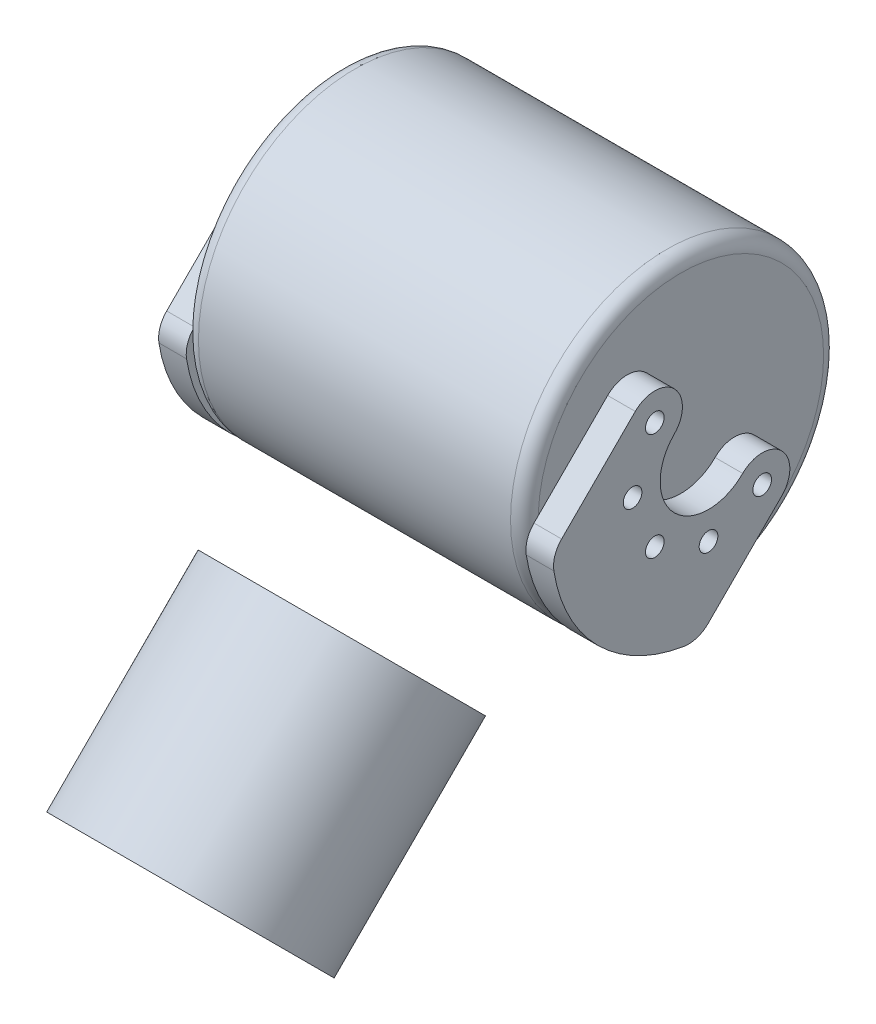
from build123d import *

# Parameters (mm, degrees)
BOSS_EXTRUDE1_START = 24.6
SKETCH2_R           = 1.35
BOSS_EXTRUDE1_DEPTH = 4
FILLET1_R           = 4
BOSS_EXTRUDE3_START = -24.6
SKETCH3_R           = 22.670832933
BOSS_EXTRUDE3_DEPTH = 49.2
FILLET2_R           = 2
SKETCH4_R           = 17
SKETCH4_R_2         = 12.95
BOSS_EXTRUDE4_DEPTH = 30
BOSS_EXTRUDE5_START = 1
SKETCH5_R           = 17
SKETCH5_R_2         = 15
BOSS_EXTRUDE5_DEPTH = 1


# Read off the part's stored shape, not the designer's step: Body-Move/Copy2
with BuildPart() as part:
    # Body-Move/Copy2 outline → Body-Move/Copy2 (revolve)
    with BuildSketch(Plane(origin=(0, 176.776695297, 176.776695297), x_dir=(1, 0, 0), z_dir=(0, 0.7071067811865516, 0.7071067811865436))):
        with BuildLine():
            Line((10.95, -34.670832933), (10.95, -53.670832933))
            Line((10.95, -53.670832933), (12.95, -53.670832933))
            Line((12.95, -53.670832933), (12.95, -49.40288374))
            ThreePointArc((12.95, -49.40288374), (12.2, -48.103845634), (12.95, -46.804807529))
            Line((12.95, -46.804807529), (12.95, -42.536858337))
            ThreePointArc((12.95, -42.536858337), (12.2, -41.237820231), (12.95, -39.938782125))
            Line((12.95, -39.938782125), (12.95, -35.670832933))
            Line((12.95, -35.670832933), (15, -35.670832933))
            Line((15, -35.670832933), (15, -34.670832933))
            Line((15, -34.670832933), (10.95, -34.670832933))
        make_face()
    revolve(axis=Axis((0, 176.776695297, 176.776695297), (0, 0.7071067811865436, -0.7071067811865516)))


with BuildPart() as body_2:
    # Sketch2 → Boss-Extrude1 (new body)
    with BuildSketch(Plane(origin=(0, 0, 0), x_dir=(0, 0, -1), z_dir=(1, 0, 0)).offset(BOSS_EXTRUDE1_START)):
        with BuildLine():
            Line((-187.383297014, 187.383297014), (-199.403419016, 175.363175013))
            ThreePointArc((-199.403419016, 175.363175013), (-192.807394999, 160.745995595), (-178.19021558, 154.149971577))
            Line((-178.19021558, 154.149971577), (-166.170093579, 166.170093579))
            ThreePointArc((-166.170093579, 166.170093579), (-166.170093579, 171.826947828), (-171.826947828, 171.826947828))
            ThreePointArc((-171.826947828, 171.826947828), (-181.726442765, 171.826947828), (-181.726442765, 181.726442765))
            ThreePointArc((-181.726442765, 181.726442765), (-181.726442765, 187.383297014), (-187.383297014, 187.383297014))
        make_face()
        with Locations((-184.55486989, 168.998520704)):
            Circle(SKETCH2_R, mode=Mode.SUBTRACT)
        with Locations((-184.55486989, 184.55486989)):
            Circle(SKETCH2_R, mode=Mode.SUBTRACT)
        with Locations((-187.776695297, 176.776695297)):
            Circle(SKETCH2_R, mode=Mode.SUBTRACT)
        with Locations((-176.776695297, 165.776695297)):
            Circle(SKETCH2_R, mode=Mode.SUBTRACT)
        with Locations((-168.998520704, 168.998520704)):
            Circle(SKETCH2_R, mode=Mode.SUBTRACT)
    extrude(amount=BOSS_EXTRUDE1_DEPTH)

    # Fillet1
    fillet1_edges = [body_2.edges().sort_by_distance(p)[0] for p in [
        (26.6, 154.149971577, 178.19021558),
        (26.6, 175.363175013, 199.403419016),
    ]]
    fillet(fillet1_edges, radius=FILLET1_R)


with BuildPart() as body_3:
    # Mirror1: mirrored copy
    add(body_2.part.mirror(Plane(origin=(0, 0, 0), x_dir=(0, 0, 1), z_dir=(1, 0, 0))))


with BuildPart() as body_4:
    # Sketch3 → Boss-Extrude3 (new body)
    with BuildSketch(Plane(origin=(0, 0, 0), x_dir=(0, 0, -1), z_dir=(1, 0, 0)).offset(BOSS_EXTRUDE3_START)):
        with Locations((-176.776695297, 176.776695297)):
            Circle(SKETCH3_R)
    extrude(amount=BOSS_EXTRUDE3_DEPTH)

    # Fillet2
    fillet2_edges = [body_4.edges().sort_by_distance(p)[0] for p in [
        (24.6, 176.776695297, 199.447528229),
        (-24.6, 176.776695297, 199.447528229),
    ]]
    fillet(fillet2_edges, radius=FILLET2_R)


with BuildPart() as body_5:
    # Sketch4 → Boss-Extrude4 (new body)
    with BuildSketch(Plane(origin=(0, -25.223087857, 25.223087857), x_dir=(1, 0, 0), z_dir=(0, -0.7071067811865437, 0.7071067811865515))):
        with Locations(Location((0, 250, 0), (0, 0, 270))):
            Circle(SKETCH4_R)
        with Locations(Location((0, 250, 0), (0, 0, 270))):
            Circle(SKETCH4_R_2, mode=Mode.SUBTRACT)
    extrude(amount=BOSS_EXTRUDE4_DEPTH)

    # Sketch5 → Boss-Extrude5 (add)
    with BuildSketch(Plane(origin=(0, -25.223087857, 25.223087857), x_dir=(1, 0, 0), z_dir=(0, 0.7071067811865438, -0.7071067811865513)).offset(BOSS_EXTRUDE5_START)):
        with Locations(Location((0, -250, 0), (0, 0, 270))):
            Circle(SKETCH5_R)
        with Locations(Location((0, -250, 0), (0, 0, 270))):
            Circle(SKETCH5_R_2, mode=Mode.SUBTRACT)
    extrude(amount=-BOSS_EXTRUDE5_DEPTH)


solid = Compound([part.part, body_2.part, body_3.part, body_4.part, body_5.part])
